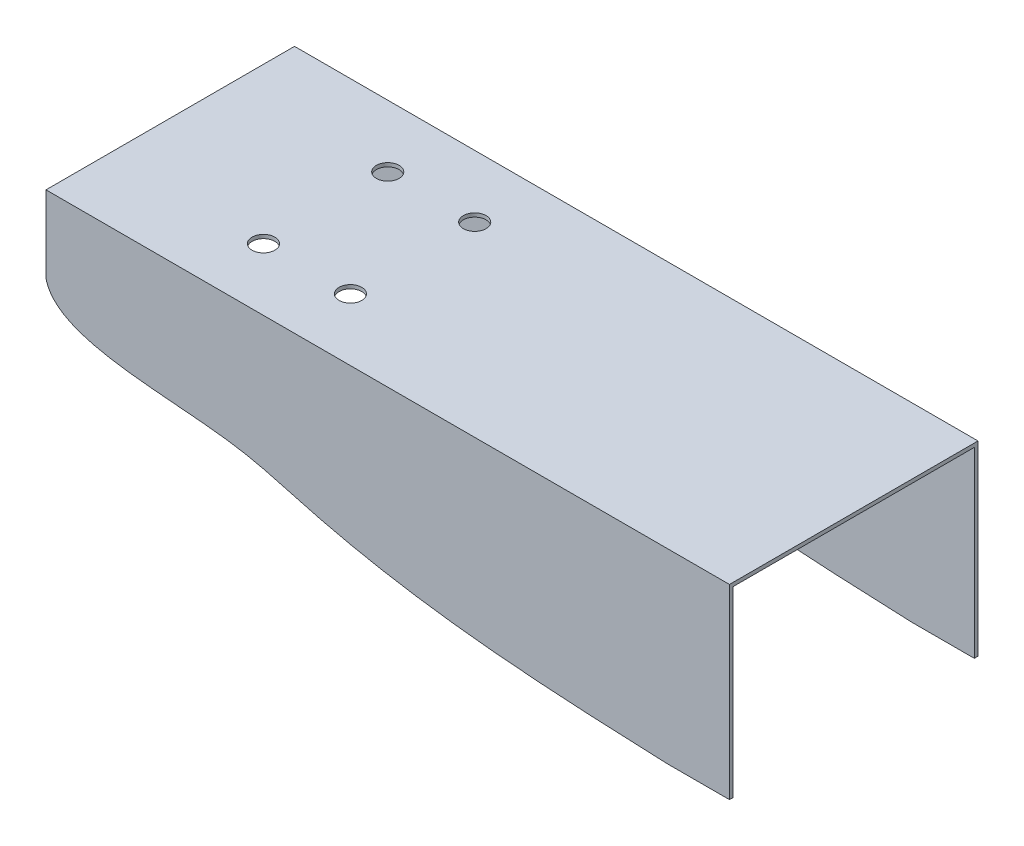
from build123d import *

# Parameters (mm, degrees)
EXTRUDE_1_DEPTH     = 550
CUT_EXTRUDE_1_DEPTH = 605.15229868
SKETCH_3_R          = 9.144176555
CUT_EXTRUDE_2_DEPTH = 10


with BuildPart() as part:
    # Эскиз1 → Вытянуть-Тонкостенный1 (new body)
    with BuildSketch(Plane(origin=(0, 0, 0), x_dir=(0, 0, -1), z_dir=(1, 0, 0))):
        Polygon((0, 0), (0, 150), (200, 150), (200, 0), (197, 0), (197, 147), (3, 147), (3, 0), align=None)
    extrude(amount=EXTRUDE_1_DEPTH)

    # Эскиз2 → Вырез-Вытянуть1 (cut, through all)
    with BuildSketch(Plane.XY):
        with BuildLine():
            Line((0, 88.192958844), (0, 0))
            Line((0, 0), (500, 0))
            add(Edge.make_bspline(
                [(500, 0), (390.353599171, 4.239380325), (282.892481103, 10.553740913), (127.197269036, 58.204047876), (8.844382343, 51.143673432), (0, 88.192958844)],
                knots=[0, 0, 0, 0, 0.60901349, 0.70901349, 1, 1, 1, 1], degree=3))
        make_face()
    extrude(amount=-CUT_EXTRUDE_1_DEPTH, mode=Mode.SUBTRACT)

    # Эскиз3 → Вырез-Вытянуть2 (cut)
    with BuildSketch(Plane(origin=(0, 150, 0), x_dir=(1, 0, 0), z_dir=(0, 1, 0))):
        with Locations((125, 150)):
            Circle(SKETCH_3_R)
        with Locations((125, 50)):
            Circle(SKETCH_3_R)
        with Locations((195, 50)):
            Circle(SKETCH_3_R)
        with Locations((195, 150)):
            Circle(SKETCH_3_R)
    extrude(amount=-CUT_EXTRUDE_2_DEPTH, mode=Mode.SUBTRACT)


solid = part.part
